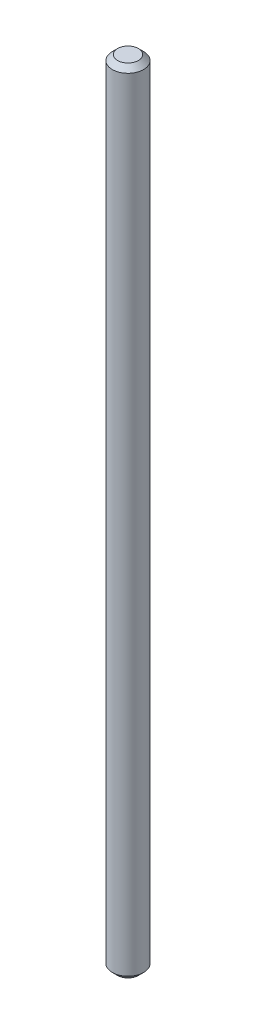
from build123d import *

# Parameters (mm, degrees)
SKETCH2_R           = 1.5
BOSS_EXTRUDE1_DEPTH = 76
CHAMFER1_SIZE       = 0.5


with BuildPart() as part:
    # Sketch2 → Boss-Extrude1 (new body)
    with BuildSketch(Plane(origin=(0, 0, 0), x_dir=(1, 0, 0), z_dir=(0, 1, 0))):
        Circle(SKETCH2_R)
    extrude(amount=BOSS_EXTRUDE1_DEPTH)

    # Chamfer1
    chamfer1_edges = [part.edges().sort_by_distance(p)[0] for p in [
        (-1.5, 76, 0),
        (-1.5, 0, 0),
    ]]
    chamfer(chamfer1_edges, length=CHAMFER1_SIZE)


solid = part.part
